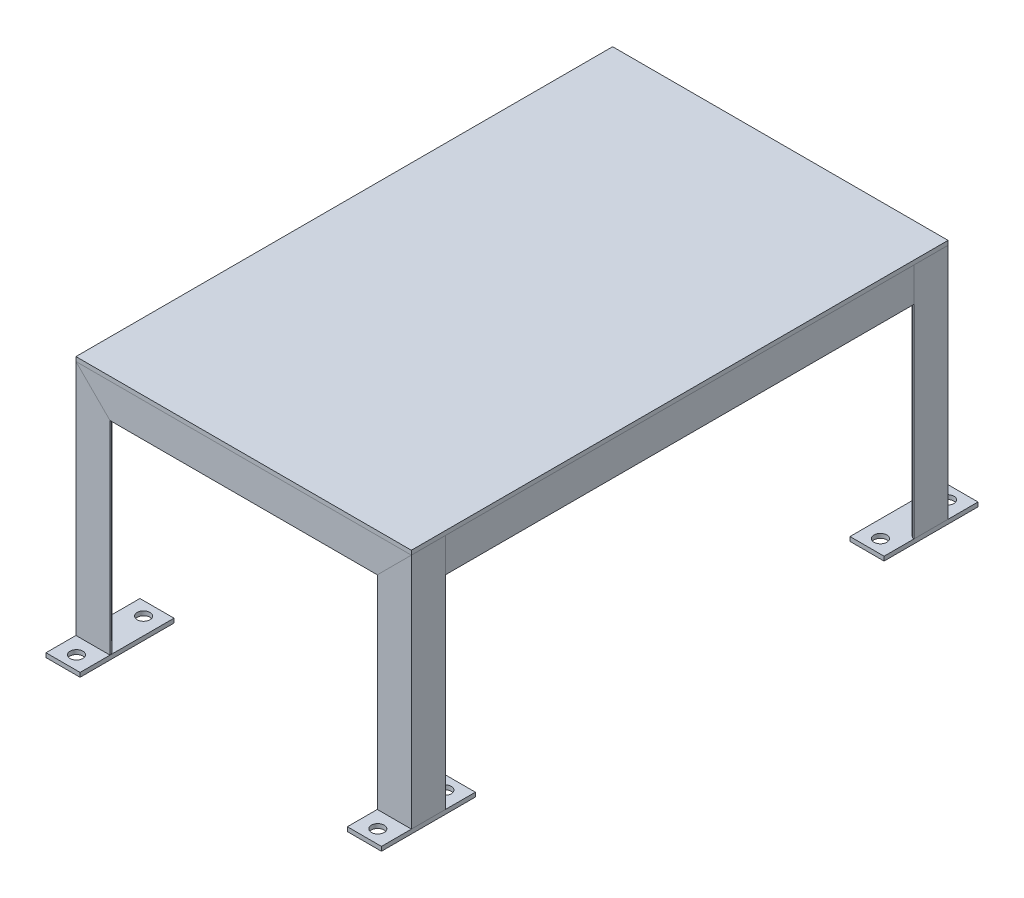
from build123d import *
from build123d.topology import SkipClean

# Parameters (mm, degrees)
L_START                       = -174.6
L_ANGLE_L1X1X0_125_1_DEPTH    = 349.2
L_START_2                     = -193.457403955
L_ANGLE_L1X1X0_125_1_2_DEPTH  = 386.91480791
L_START_3                     = -61
L_ANGLE_L1X1X0_125_1_3_DEPTH  = 4.849744118
L_ANGLE_L1X1X0_125_1_4_DEPTH  = 4.849744118
L_ANGLE_L1X1X0_125_1_5_DEPTH  = 151.425
L_START_4                     = -200
L_ANGLE_L1X1X0_125_1_6_DEPTH  = 7.9375
L_START_5                     = -192.82775753
L_ANGLE_L1X1X0_125_1_7_DEPTH  = 18.22775753
L_START_6                     = 151.425
L_ANGLE_L1X1X0_125_1_8_DEPTH  = 25.4
L_START_7                     = -99.6
L_ANGLE_L1X1X0_125_1_9_DEPTH  = 199.2
L_ANGLE_L1X1X0_125_1_10_DEPTH = 22.23008
L_START_8                     = -196.825
L_ANGLE_L1X1X0_125_1_11_DEPTH = 22.225
L_START_9                     = -125
L_ANGLE_L1X1X0_125_1_12_DEPTH = 250
L_ANGLE_L1X1X0_125_1_13_DEPTH = 349.2
L_ANGLE_L1X1X0_125_1_14_DEPTH = 386.91480791
L_START_10                    = 56.150255882
L_ANGLE_L1X1X0_125_1_15_DEPTH = 4.849744118
L_ANGLE_L1X1X0_125_1_16_DEPTH = 4.849744118
L_ANGLE_L1X1X0_125_1_17_DEPTH = 151.425
L_ANGLE_L1X1X0_125_1_18_DEPTH = 7.9375
L_ANGLE_L1X1X0_125_1_19_DEPTH = 18.22775753
L_ANGLE_L1X1X0_125_1_20_DEPTH = 25.4
L_ANGLE_L1X1X0_125_1_21_DEPTH = 151.425
L_START_11                    = 192.0625
L_ANGLE_L1X1X0_125_1_22_DEPTH = 7.9375
L_START_12                    = 174.6
L_ANGLE_L1X1X0_125_1_23_DEPTH = 18.187266949
L_ANGLE_L1X1X0_125_1_24_DEPTH = 25.4
L_ANGLE_L1X1X0_125_1_25_DEPTH = 199.2
L_START_13                    = 177.76992
L_ANGLE_L1X1X0_125_1_26_DEPTH = 22.23008
L_ANGLE_L1X1X0_125_1_27_DEPTH = 22.225
L_ANGLE_L1X1X0_125_1_28_DEPTH = 250
L_ANGLE_L1X1X0_125_1_29_DEPTH = 151.425
L_ANGLE_L1X1X0_125_1_30_DEPTH = 7.9375
L_ANGLE_L1X1X0_125_1_31_DEPTH = 18.187266949
L_ANGLE_L1X1X0_125_1_32_DEPTH = 25.4
CROQUIS5_W                    = 250
CROQUIS5_H                    = 400
SALIENTE_EXTRUIR1_DEPTH       = 3.175
CROQUIS6_W                    = 25.4
CROQUIS6_H                    = 70
CROQUIS6_R                    = 4.7625
SALIENTE_EXTRUIR2_DEPTH       = 3.175
MATRIZL1_COUNT                = 2
MATRIZL1_PITCH                = 374.6
MATRIZL1_COUNT_DIR2           = 2
MATRIZL1_PITCH_DIR2           = 224.6


with BuildPart() as part:
    # L angle L1X1X0.125(1): read off the stored shape, not the designer's step
    # L angle L1X1X0.125(1) outline → L angle L1X1X0.125(1) (new body)
    with BuildSketch(Plane.XY.offset(L_START)):
        with BuildLine():
            Line((-125, 176.825), (-125, 151.425))
            Line((-125, 151.425), (-124.99492, 151.425))
            ThreePointArc((-124.99492, 151.425), (-122.753448072, 152.353448072), (-121.825, 154.59492))
            Line((-121.825, 154.59492), (-121.825, 168.8875))
            ThreePointArc((-121.825, 168.8875), (-120.430096045, 172.255096045), (-117.0625, 173.65))
            Line((-117.0625, 173.65), (-102.76992, 173.65))
            ThreePointArc((-102.76992, 173.65), (-100.528448072, 174.578448072), (-99.6, 176.81992))
            Line((-99.6, 176.81992), (-99.6, 176.825))
            Line((-99.6, 176.825), (-125, 176.825))
        make_face()
    extrude(amount=L_ANGLE_L1X1X0_125_1_DEPTH)

    # L angle L1X1X0.125_1 2 outline → L angle L1X1X0.125_1 2 (add)
    with BuildSketch(Plane.XY.offset(L_START_2)):
        with BuildLine():
            Line((-121.825, 173.65), (-121.825, 168.8875))
            ThreePointArc((-121.825, 168.8875), (-120.430096045, 172.255096045), (-117.0625, 173.65))
            Line((-117.0625, 173.65), (-121.825, 173.65))
        make_face()
    extrude(amount=L_ANGLE_L1X1X0_125_1_2_DEPTH)

    # L angle L1X1X0.125_1 3 outline → L angle L1X1X0.125_1 3 (cut)
    with BuildSketch(Plane(origin=(0, 0, 0), x_dir=(0.8164965809277261, 0.4082482904638625, -0.4082482904638631), z_dir=(0.5773502691896255, -0.5773502691896255, 0.5773502691896263)).offset(L_START_3)):
        Polygon((-109.641102171, 254), (-108.930850103, 255.230192669), (-106.98656762, 258.597788715), (-102, 258.597788715), (-102, 261), (-111, 261), (-111, 254), align=None)
    extrude(amount=L_ANGLE_L1X1X0_125_1_3_DEPTH, mode=Mode.SUBTRACT)

    # L angle L1X1X0.125_1 4 outline → L angle L1X1X0.125_1 4 (cut)
    with BuildSketch(Plane(origin=(0, 0, 0), x_dir=(0.8164965809277289, 0.40824829046385586, 0.4082482904638645), z_dir=(0.5773502691896217, -0.5773502691896217, -0.577350269189634)).offset(L_START_3)):
        Polygon((-102, -258.597788715), (-106.98656762, -258.597788715), (-108.930850103, -255.230192669), (-109.641102171, -254), (-111, -254), (-111, -261), (-102, -261), align=None)
    extrude(amount=L_ANGLE_L1X1X0_125_1_4_DEPTH, mode=Mode.SUBTRACT)


with BuildPart() as body_2:
    # L angle L1X1X0.125_1 5 outline → L angle L1X1X0.125_1 5 (new body)
    with BuildSketch(Plane(origin=(0, 0, 0), x_dir=(1, 0, 0), z_dir=(0, 1, 0))):
        with BuildLine():
            Line((-125, 200), (-125, 174.6))
            Line((-125, 174.6), (-124.99492, 174.6))
            ThreePointArc((-124.99492, 174.6), (-122.753448072, 175.528448072), (-121.825, 177.76992))
            Line((-121.825, 177.76992), (-121.825, 192.0625))
            ThreePointArc((-121.825, 192.0625), (-120.430096045, 195.430096045), (-117.0625, 196.825))
            Line((-117.0625, 196.825), (-102.76992, 196.825))
            ThreePointArc((-102.76992, 196.825), (-100.528448072, 197.753448072), (-99.6, 199.99492))
            Line((-99.6, 199.99492), (-99.6, 200))
            Line((-99.6, 200), (-125, 200))
        make_face()
    extrude(amount=L_ANGLE_L1X1X0_125_1_5_DEPTH)

    # L angle L1X1X0.125_1 6 outline → L angle L1X1X0.125_1 6 (add)
    with BuildSketch(Plane.XY.offset(L_START_4)):
        Polygon((-125, 176.825), (-125, 151.425), (-99.6, 151.425), align=None)
    extrude(amount=L_ANGLE_L1X1X0_125_1_6_DEPTH)

    # L angle L1X1X0.125_1 7 outline → L angle L1X1X0.125_1 7 (add)
    with BuildSketch(Plane.XY.offset(L_START_5)):
        Polygon((-125, 176.825), (-125, 151.425), (-121.825, 151.425), (-121.825, 173.65), align=None)
    extrude(amount=L_ANGLE_L1X1X0_125_1_7_DEPTH)

    # L angle L1X1X0.125_1 8 outline → L angle L1X1X0.125_1 8 (cut)
    with BuildSketch(Plane(origin=(0, 0, 0), x_dir=(1, 0, 0), z_dir=(0, 1, 0)).offset(L_START_6)):
        with BuildLine():
            ThreePointArc((-117.0625, 196.825), (-120.430096045, 195.430096045), (-121.825, 192.0625))
            Line((-121.825, 192.0625), (-99.6, 192.0625))
            Line((-99.6, 192.0625), (-99.6, 199.99492))
            ThreePointArc((-99.6, 199.99492), (-100.528448072, 197.753448072), (-102.76992, 196.825))
            Line((-102.76992, 196.825), (-117.0625, 196.825))
        make_face()
        with BuildLine():
            ThreePointArc((-121.825, 177.76992), (-122.753448072, 175.528448072), (-124.99492, 174.6))
            Line((-124.99492, 174.6), (-121.825, 174.6))
            Line((-121.825, 174.6), (-121.825, 177.76992))
        make_face()
    extrude(amount=L_ANGLE_L1X1X0_125_1_8_DEPTH, mode=Mode.SUBTRACT)


with BuildPart() as body_3:
    # L angle L1X1X0.125_1 9 outline → L angle L1X1X0.125_1 9 (new body)
    with BuildSketch(Plane.YZ.offset(L_START_7)):
        with BuildLine():
            Line((176.825, -200), (176.825, -174.6))
            Line((176.825, -174.6), (176.81992, -174.6))
            ThreePointArc((176.81992, -174.6), (174.578448072, -175.528448072), (173.65, -177.76992))
            Line((173.65, -177.76992), (173.65, -192.0625))
            ThreePointArc((173.65, -192.0625), (172.255096045, -195.430096045), (168.8875, -196.825))
            Line((168.8875, -196.825), (154.59492, -196.825))
            ThreePointArc((154.59492, -196.825), (152.353448072, -197.753448072), (151.425, -199.99492))
            Line((151.425, -199.99492), (151.425, -200))
            Line((151.425, -200), (176.825, -200))
        make_face()
    extrude(amount=L_ANGLE_L1X1X0_125_1_9_DEPTH)

    # L angle L1X1X0.125_1 10 outline → L angle L1X1X0.125_1 10 (add)
    with BuildSketch(Plane.XY.offset(L_START_4)):
        Polygon((-99.6, 176.825), (-125, 176.825), (-99.6, 151.425), align=None)
        Polygon((125, 176.825), (99.6, 176.825), (99.6, 151.425), align=None)
    extrude(amount=L_ANGLE_L1X1X0_125_1_10_DEPTH)

    # L angle L1X1X0.125_1 11 outline → L angle L1X1X0.125_1 11 (add)
    with BuildSketch(Plane.XY.offset(L_START_8)):
        Polygon((-99.6, 176.825), (-125, 176.825), (-121.825, 173.65), (-99.6, 173.65), align=None)
        Polygon((125, 176.825), (99.6, 176.825), (99.6, 173.65), (121.825, 173.65), align=None)
    extrude(amount=L_ANGLE_L1X1X0_125_1_11_DEPTH)

    # L angle L1X1X0.125_1 12 outline → L angle L1X1X0.125_1 12 (cut)
    with SkipClean():  # the faces are left unmerged after this step: merging them gives an invalid solid
        with BuildSketch(Plane.YZ.offset(L_START_9)):
            with BuildLine():
                Line((173.65, -192.0625), (173.65, -177.76992))
                Line((173.65, -177.76992), (151.425, -177.76992))
                Line((151.425, -177.76992), (151.425, -199.99492))
                ThreePointArc((151.425, -199.99492), (152.353448072, -197.753448072), (154.59492, -196.825))
                Line((154.59492, -196.825), (168.8875, -196.825))
                ThreePointArc((168.8875, -196.825), (172.255096045, -195.430096045), (173.65, -192.0625))
            make_face()
            with BuildLine():
                Line((173.65, -174.6), (173.65, -177.76992))
                ThreePointArc((173.65, -177.76992), (174.578448072, -175.528448072), (176.81992, -174.6))
                Line((176.81992, -174.6), (173.65, -174.6))
            make_face()
        extrude(amount=L_ANGLE_L1X1X0_125_1_12_DEPTH, mode=Mode.SUBTRACT)


with BuildPart() as body_4:
    # L angle L1X1X0.125_1 13 outline → L angle L1X1X0.125_1 13 (new body)
    with BuildSketch(Plane.XY.offset(L_START)):
        with BuildLine():
            Line((125, 176.825), (99.6, 176.825))
            Line((99.6, 176.825), (99.6, 176.81992))
            ThreePointArc((99.6, 176.81992), (100.528448072, 174.578448072), (102.76992, 173.65))
            Line((102.76992, 173.65), (117.0625, 173.65))
            ThreePointArc((117.0625, 173.65), (120.430096045, 172.255096045), (121.825, 168.8875))
            Line((121.825, 168.8875), (121.825, 154.59492))
            ThreePointArc((121.825, 154.59492), (122.753448072, 152.353448072), (124.99492, 151.425))
            Line((124.99492, 151.425), (125, 151.425))
            Line((125, 151.425), (125, 176.825))
        make_face()
    extrude(amount=L_ANGLE_L1X1X0_125_1_13_DEPTH)

    # L angle L1X1X0.125_1 14 outline → L angle L1X1X0.125_1 14 (add)
    with BuildSketch(Plane.XY.offset(L_START_2)):
        with BuildLine():
            Line((121.825, 173.65), (117.0625, 173.65))
            ThreePointArc((117.0625, 173.65), (120.430096045, 172.255096045), (121.825, 168.8875))
            Line((121.825, 168.8875), (121.825, 173.65))
        make_face()
    extrude(amount=L_ANGLE_L1X1X0_125_1_14_DEPTH)

    # L angle L1X1X0.125_1 15 outline → L angle L1X1X0.125_1 15 (cut)
    with BuildSketch(Plane(origin=(0, 0, 0), x_dir=(0.8164965809277261, -0.4082482904638625, 0.4082482904638631), z_dir=(0.5773502691896255, 0.5773502691896255, -0.5773502691896263)).offset(L_START_10)):
        Polygon((108.930850103, -255.230192669), (106.98656762, -258.597788715), (102, -258.597788715), (102, -261), (111, -261), (111, -254), (109.641102171, -254), align=None)
    extrude(amount=L_ANGLE_L1X1X0_125_1_15_DEPTH, mode=Mode.SUBTRACT)

    # L angle L1X1X0.125_1 16 outline → L angle L1X1X0.125_1 16 (cut)
    with BuildSketch(Plane(origin=(0, 0, 0), x_dir=(0.8164965809277289, -0.40824829046385586, -0.4082482904638645), z_dir=(0.5773502691896217, 0.5773502691896217, 0.577350269189634)).offset(L_START_10)):
        Polygon((102, 258.597788715), (106.98656762, 258.597788715), (108.930850103, 255.230192669), (109.641102171, 254), (111, 254), (111, 261), (102, 261), align=None)
    extrude(amount=L_ANGLE_L1X1X0_125_1_16_DEPTH, mode=Mode.SUBTRACT)


with BuildPart() as body_5:
    # L angle L1X1X0.125_1 17 outline → L angle L1X1X0.125_1 17 (new body)
    with BuildSketch(Plane(origin=(0, 0, 0), x_dir=(1, 0, 0), z_dir=(0, 1, 0))):
        with BuildLine():
            Line((125, 174.6), (125, 200))
            Line((125, 200), (99.6, 200))
            Line((99.6, 200), (99.6, 199.99492))
            ThreePointArc((99.6, 199.99492), (100.528448072, 197.753448072), (102.76992, 196.825))
            Line((102.76992, 196.825), (117.0625, 196.825))
            ThreePointArc((117.0625, 196.825), (120.430096045, 195.430096045), (121.825, 192.0625))
            Line((121.825, 192.0625), (121.825, 177.76992))
            ThreePointArc((121.825, 177.76992), (122.753448072, 175.528448072), (124.99492, 174.6))
            Line((124.99492, 174.6), (125, 174.6))
        make_face()
    extrude(amount=L_ANGLE_L1X1X0_125_1_17_DEPTH)

    # L angle L1X1X0.125_1 18 outline → L angle L1X1X0.125_1 18 (add)
    with BuildSketch(Plane.XY.offset(L_START_4)):
        Polygon((125, 151.425), (125, 176.825), (99.6, 151.425), align=None)
    extrude(amount=L_ANGLE_L1X1X0_125_1_18_DEPTH)

    # L angle L1X1X0.125_1 19 outline → L angle L1X1X0.125_1 19 (add)
    with BuildSketch(Plane.XY.offset(L_START_5)):
        Polygon((125, 151.425), (125, 176.825), (121.825, 173.65), (121.825, 151.425), align=None)
    extrude(amount=L_ANGLE_L1X1X0_125_1_19_DEPTH)

    # L angle L1X1X0.125_1 20 outline → L angle L1X1X0.125_1 20 (cut)
    with BuildSketch(Plane(origin=(0, 0, 0), x_dir=(1, 0, 0), z_dir=(0, 1, 0)).offset(L_START_6)):
        with BuildLine():
            ThreePointArc((102.76992, 196.825), (100.528448072, 197.753448072), (99.6, 199.99492))
            Line((99.6, 199.99492), (99.6, 192.0625))
            Line((99.6, 192.0625), (121.825, 192.0625))
            ThreePointArc((121.825, 192.0625), (120.430096045, 195.430096045), (117.0625, 196.825))
            Line((117.0625, 196.825), (102.76992, 196.825))
        make_face()
        with BuildLine():
            ThreePointArc((124.99492, 174.6), (122.753448072, 175.528448072), (121.825, 177.76992))
            Line((121.825, 177.76992), (121.825, 174.6))
            Line((121.825, 174.6), (124.99492, 174.6))
        make_face()
    extrude(amount=L_ANGLE_L1X1X0_125_1_20_DEPTH, mode=Mode.SUBTRACT)


with BuildPart() as body_6:
    # L angle L1X1X0.125_1 21 outline → L angle L1X1X0.125_1 21 (new body)
    with BuildSketch(Plane(origin=(0, 0, 0), x_dir=(1, 0, 0), z_dir=(0, 1, 0))):
        with BuildLine():
            Line((-125, -200), (-99.6, -200))
            Line((-99.6, -200), (-99.6, -199.99492))
            ThreePointArc((-99.6, -199.99492), (-100.528448072, -197.753448072), (-102.76992, -196.825))
            Line((-102.76992, -196.825), (-117.0625, -196.825))
            ThreePointArc((-117.0625, -196.825), (-120.430096045, -195.430096045), (-121.825, -192.0625))
            Line((-121.825, -192.0625), (-121.825, -177.76992))
            ThreePointArc((-121.825, -177.76992), (-122.753448072, -175.528448072), (-124.99492, -174.6))
            Line((-124.99492, -174.6), (-125, -174.6))
            Line((-125, -174.6), (-125, -200))
        make_face()
    extrude(amount=L_ANGLE_L1X1X0_125_1_21_DEPTH)

    # L angle L1X1X0.125_1 22 outline → L angle L1X1X0.125_1 22 (add)
    with BuildSketch(Plane.XY.offset(L_START_11)):
        Polygon((-99.6, 151.425), (-125, 176.825), (-125, 151.425), align=None)
    extrude(amount=L_ANGLE_L1X1X0_125_1_22_DEPTH)

    # L angle L1X1X0.125_1 23 outline → L angle L1X1X0.125_1 23 (add)
    with BuildSketch(Plane.XY.offset(L_START_12)):
        Polygon((-121.825, 151.425), (-121.825, 173.65), (-125, 176.825), (-125, 151.425), align=None)
    extrude(amount=L_ANGLE_L1X1X0_125_1_23_DEPTH)

    # L angle L1X1X0.125_1 24 outline → L angle L1X1X0.125_1 24 (cut)
    with BuildSketch(Plane(origin=(0, 0, 0), x_dir=(1, 0, 0), z_dir=(0, 1, 0)).offset(L_START_6)):
        with BuildLine():
            Line((-121.825, -174.6), (-124.99492, -174.6))
            ThreePointArc((-124.99492, -174.6), (-122.753448072, -175.528448072), (-121.825, -177.76992))
            Line((-121.825, -177.76992), (-121.825, -174.6))
        make_face()
        with BuildLine():
            Line((-99.6, -192.0625), (-121.825, -192.0625))
            ThreePointArc((-121.825, -192.0625), (-120.430096045, -195.430096045), (-117.0625, -196.825))
            Line((-117.0625, -196.825), (-102.76992, -196.825))
            ThreePointArc((-102.76992, -196.825), (-100.528448072, -197.753448072), (-99.6, -199.99492))
            Line((-99.6, -199.99492), (-99.6, -192.0625))
        make_face()
    extrude(amount=L_ANGLE_L1X1X0_125_1_24_DEPTH, mode=Mode.SUBTRACT)


with BuildPart() as body_7:
    # L angle L1X1X0.125_1 25 outline → L angle L1X1X0.125_1 25 (new body)
    with BuildSketch(Plane.YZ.offset(L_START_7)):
        with BuildLine():
            Line((176.825, 200), (151.425, 200))
            Line((151.425, 200), (151.425, 199.99492))
            ThreePointArc((151.425, 199.99492), (152.353448072, 197.753448072), (154.59492, 196.825))
            Line((154.59492, 196.825), (168.8875, 196.825))
            ThreePointArc((168.8875, 196.825), (172.255096045, 195.430096045), (173.65, 192.0625))
            Line((173.65, 192.0625), (173.65, 177.76992))
            ThreePointArc((173.65, 177.76992), (174.578448072, 175.528448072), (176.81992, 174.6))
            Line((176.81992, 174.6), (176.825, 174.6))
            Line((176.825, 174.6), (176.825, 200))
        make_face()
    extrude(amount=L_ANGLE_L1X1X0_125_1_25_DEPTH)

    # L angle L1X1X0.125_1 26 outline → L angle L1X1X0.125_1 26 (add)
    with BuildSketch(Plane.XY.offset(L_START_13)):
        Polygon((-99.6, 176.825), (-125, 176.825), (-99.6, 151.425), align=None)
        Polygon((125, 176.825), (99.6, 176.825), (99.6, 151.425), align=None)
    extrude(amount=L_ANGLE_L1X1X0_125_1_26_DEPTH)

    # L angle L1X1X0.125_1 27 outline → L angle L1X1X0.125_1 27 (add)
    with BuildSketch(Plane.XY.offset(L_START_12)):
        Polygon((-99.6, 176.825), (-125, 176.825), (-121.825, 173.65), (-99.6, 173.65), align=None)
        Polygon((125, 176.825), (99.6, 176.825), (99.6, 173.65), (121.825, 173.65), align=None)
    extrude(amount=L_ANGLE_L1X1X0_125_1_27_DEPTH)

    # L angle L1X1X0.125_1 28 outline → L angle L1X1X0.125_1 28 (cut)
    with SkipClean():  # the faces are left unmerged after this step: merging them gives an invalid solid
        with BuildSketch(Plane.YZ.offset(L_START_9)):
            with BuildLine():
                Line((151.425, 199.99492), (151.425, 177.76992))
                Line((151.425, 177.76992), (173.65, 177.76992))
                Line((173.65, 177.76992), (173.65, 192.0625))
                ThreePointArc((173.65, 192.0625), (172.255096045, 195.430096045), (168.8875, 196.825))
                Line((168.8875, 196.825), (154.59492, 196.825))
                ThreePointArc((154.59492, 196.825), (152.353448072, 197.753448072), (151.425, 199.99492))
            make_face()
            with BuildLine():
                ThreePointArc((176.81992, 174.6), (174.578448072, 175.528448072), (173.65, 177.76992))
                Line((173.65, 177.76992), (173.65, 174.6))
                Line((173.65, 174.6), (176.81992, 174.6))
            make_face()
        extrude(amount=L_ANGLE_L1X1X0_125_1_28_DEPTH, mode=Mode.SUBTRACT)


with BuildPart() as body_8:
    # L angle L1X1X0.125_1 29 outline → L angle L1X1X0.125_1 29 (new body)
    with BuildSketch(Plane(origin=(0, 0, 0), x_dir=(1, 0, 0), z_dir=(0, 1, 0))):
        with BuildLine():
            Line((99.6, -200), (125, -200))
            Line((125, -200), (125, -174.6))
            Line((125, -174.6), (124.99492, -174.6))
            ThreePointArc((124.99492, -174.6), (122.753448072, -175.528448072), (121.825, -177.76992))
            Line((121.825, -177.76992), (121.825, -192.0625))
            ThreePointArc((121.825, -192.0625), (120.430096045, -195.430096045), (117.0625, -196.825))
            Line((117.0625, -196.825), (102.76992, -196.825))
            ThreePointArc((102.76992, -196.825), (100.528448072, -197.753448072), (99.6, -199.99492))
            Line((99.6, -199.99492), (99.6, -200))
        make_face()
    extrude(amount=L_ANGLE_L1X1X0_125_1_29_DEPTH)

    # L angle L1X1X0.125_1 30 outline → L angle L1X1X0.125_1 30 (add)
    with BuildSketch(Plane.XY.offset(L_START_11)):
        Polygon((99.6, 151.425), (125, 151.425), (125, 176.825), align=None)
    extrude(amount=L_ANGLE_L1X1X0_125_1_30_DEPTH)

    # L angle L1X1X0.125_1 31 outline → L angle L1X1X0.125_1 31 (add)
    with BuildSketch(Plane.XY.offset(L_START_12)):
        Polygon((121.825, 173.65), (121.825, 151.425), (125, 151.425), (125, 176.825), align=None)
    extrude(amount=L_ANGLE_L1X1X0_125_1_31_DEPTH)

    # L angle L1X1X0.125_1 32 outline → L angle L1X1X0.125_1 32 (cut)
    with BuildSketch(Plane(origin=(0, 0, 0), x_dir=(1, 0, 0), z_dir=(0, 1, 0)).offset(L_START_6)):
        with BuildLine():
            Line((121.825, -192.0625), (99.6, -192.0625))
            Line((99.6, -192.0625), (99.6, -199.99492))
            ThreePointArc((99.6, -199.99492), (100.528448072, -197.753448072), (102.76992, -196.825))
            Line((102.76992, -196.825), (117.0625, -196.825))
            ThreePointArc((117.0625, -196.825), (120.430096045, -195.430096045), (121.825, -192.0625))
        make_face()
        with BuildLine():
            Line((124.99492, -174.6), (121.825, -174.6))
            Line((121.825, -174.6), (121.825, -177.76992))
            ThreePointArc((121.825, -177.76992), (122.753448072, -175.528448072), (124.99492, -174.6))
        make_face()
    extrude(amount=L_ANGLE_L1X1X0_125_1_32_DEPTH, mode=Mode.SUBTRACT)


with BuildPart() as body_9:
    # Croquis5 → Saliente-Extruir1 (new body)
    with BuildSketch(Plane(origin=(0, 176.825, 0), x_dir=(1, 0, 0), z_dir=(0, 1, 0))):
        Rectangle(CROQUIS5_W, CROQUIS5_H)
    extrude(amount=SALIENTE_EXTRUIR1_DEPTH)


with BuildPart() as body_10:
    # Croquis6 → Saliente-Extruir2 (new body)
    with BuildSketch(Plane.XZ):
        with Locations((112.3, -187.29746)):
            Rectangle(CROQUIS6_W, CROQUIS6_H)
        with Locations((112.3, -212.29746)):
            Circle(CROQUIS6_R, mode=Mode.SUBTRACT)
        with Locations((112.3, -162.29746)):
            Circle(CROQUIS6_R, mode=Mode.SUBTRACT)
    saliente_extruir2 = extrude(amount=SALIENTE_EXTRUIR2_DEPTH)


with BuildPart() as matrizl1_1:
    # MatrizL1: Saliente-Extruir2 2 × 2
    with Locations(*[(-j * MATRIZL1_PITCH_DIR2, 0, i * MATRIZL1_PITCH) for i in range(MATRIZL1_COUNT) for j in range(MATRIZL1_COUNT_DIR2) if (i, j) != (0, 0)]):
        add(saliente_extruir2)


solid = Compound([part.part, body_2.part, body_3.part, body_4.part, body_5.part, body_6.part, body_7.part, body_8.part, body_9.part, body_10.part, matrizl1_1.part])
